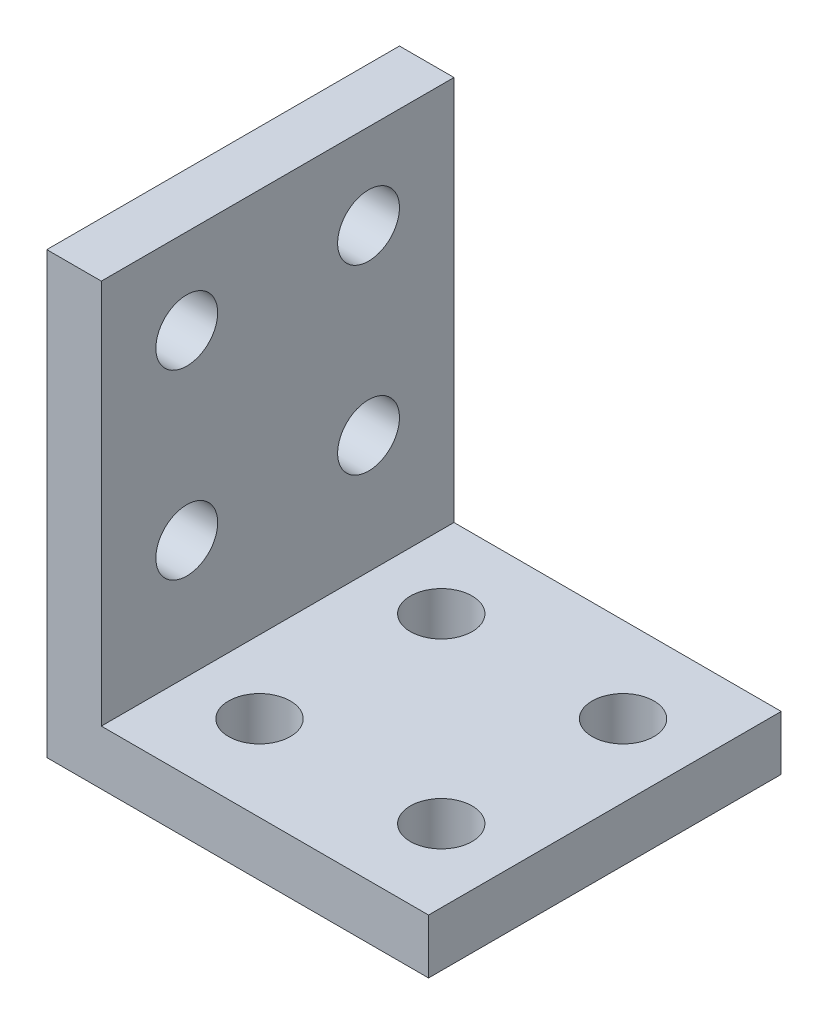
from build123d import *

# Parameters (mm, degrees)
BOSS_EXTRUDE1_DEPTH  = 19.4
M3_CLEARANCE_HOLE1_D = 3.4
M3_CLEARANCE_HOLE2_D = 3.4


with BuildPart() as part:
    # Sketch1 → Boss-Extrude1 (new body)
    with BuildSketch(Plane.XY):
        Polygon((0, 24.2), (0, 0), (21, 0), (21, 3), (3, 3), (3, 24.2), align=None)
    extrude(amount=BOSS_EXTRUDE1_DEPTH)

    # M3 Clearance Hole1 (through all)
    with Locations(Plane(origin=(0, 3, 0), x_dir=(1, 0, 0), z_dir=(0, 1, 0))):
        with Locations((7, -14.7), (7, -4.7), (17, -4.7), (17, -14.7)):
            Hole(M3_CLEARANCE_HOLE1_D / 2)

    # M3 Clearance Hole2 (through all)
    with Locations(Plane(origin=(3, 0, 0), x_dir=(0, 0, -1), z_dir=(1, 0, 0))):
        with Locations((-14.7, 9.5), (-4.7, 9.5), (-4.7, 19.5), (-14.7, 19.5)):
            Hole(M3_CLEARANCE_HOLE2_D / 2)


solid = part.part
